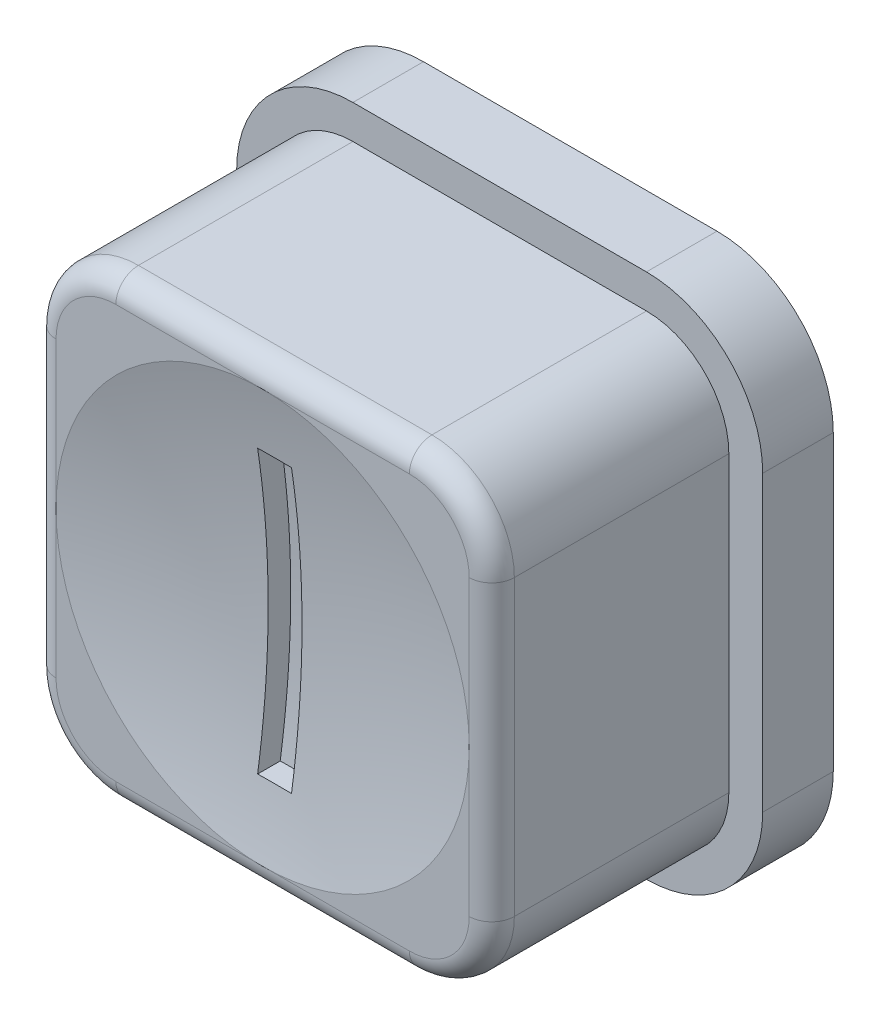
from build123d import *

# Parameters (mm, degrees)
BOSS_EXTRUDE1_DEPTH              = 5.334
FILLET1_R                        = 0.508
BOSS_EXTRUDE2_DEPTH              = 1.5875
F_56_0_0465_DIAMETER_HOLE1_D     = 1.1811
F_56_0_0465_DIAMETER_HOLE1_DEPTH = 5.08
CUT_EXTRUDE3_REACH               = 13.369
CUT_EXTRUDE3_START_RADIUS        = 21.519514579
CUT_EXTRUDE3_END_RADIUS          = 21.519514579
SKETCH9_W                        = 0.762
SKETCH9_H                        = 6.35


with BuildPart() as part:
    # Sketch1 → Boss-Extrude1 (new body)
    with BuildSketch(Plane.XY):
        with BuildLine():
            Line((3.301999954, 5.156199954), (-3.301999954, 5.156199954))
            ThreePointArc((-3.301999954, 5.156199954), (-4.613117348, 4.613117348), (-5.156199954, 3.301999954))
            Line((-5.156199954, 3.301999954), (-5.156199954, -3.301999954))
            ThreePointArc((-5.156199954, -3.301999954), (-4.613117348, -4.613117348), (-3.301999954, -5.156199954))
            Line((-3.301999954, -5.156199954), (3.301999954, -5.156199954))
            ThreePointArc((3.301999954, -5.156199954), (4.613117348, -4.613117348), (5.156199954, -3.301999954))
            Line((5.156199954, -3.301999954), (5.156199954, 3.301999954))
            ThreePointArc((5.156199954, 3.301999954), (4.613117348, 4.613117348), (3.301999954, 5.156199954))
        make_face()
    extrude(amount=-BOSS_EXTRUDE1_DEPTH)

    # Fillet1
    fillet1_edges = [part.edges().sort_by_distance(p)[0] for p in [
        (5.156199954, 0, 0),
        (4.613117348, -4.613117348, 0),
        (0, -5.156199954, 0),
        (-4.613117348, -4.613117348, 0),
        (-5.156199954, 0, 0),
        (-4.613117348, 4.613117348, 0),
        (0, 5.156199954, 0),
        (4.613117348, 4.613117348, 0),
    ]]
    fillet(fillet1_edges, radius=FILLET1_R)

    # Sketch4 → Boss-Extrude2 (add)
    with BuildSketch(Plane(origin=(0, 0, -5.334), x_dir=(-1, 0, 0), z_dir=(0, 0, -1))):
        with BuildLine():
            Line((-5.918199954, 3.301999954), (-5.918199954, -3.301999954))
            ThreePointArc((-5.918199954, -3.301999954), (-5.151932715, -5.151932715), (-3.301999954, -5.918199954))
            Line((-3.301999954, -5.918199954), (3.301999954, -5.918199954))
            ThreePointArc((3.301999954, -5.918199954), (5.151932715, -5.151932715), (5.918199954, -3.301999954))
            Line((5.918199954, -3.301999954), (5.918199954, 3.301999954))
            ThreePointArc((5.918199954, 3.301999954), (5.151932715, 5.151932715), (3.301999954, 5.918199954))
            Line((3.301999954, 5.918199954), (-3.301999954, 5.918199954))
            ThreePointArc((-3.301999954, 5.918199954), (-5.151932715, 5.151932715), (-5.918199954, 3.301999954))
        make_face()
    extrude(amount=BOSS_EXTRUDE2_DEPTH)

    # #56 (0.0465) Diameter Hole1
    with Locations(Plane(origin=(0, 0, -6.9215), x_dir=(-1, 0, 0), z_dir=(0, 0, -1))):
        with Locations((0, 0)):
            Hole(F_56_0_0465_DIAMETER_HOLE1_D / 2, depth=F_56_0_0465_DIAMETER_HOLE1_DEPTH)

    # Sketch8 → Cut-Revolve1 (revolve, cut)
    with BuildSketch(Plane(origin=(0, 0, 0), x_dir=(0, 0, -1), z_dir=(1, 0, 0))):
        with BuildLine():
            Line((0, 4.648199954), (0, 0))
            Line((0, 0), (0.508, 0))
            ThreePointArc((0.508, 0), (0.380623019, 2.337938558), (0, 4.648199954))
        make_face()
    revolve(axis=Axis((0, 0, -0.508), (0, 0, 1)), mode=Mode.SUBTRACT)

    # Cut-Extrude3: from a sphere face, 13.369 long prism both ways, kept between that surface and its translate by the depth
    cut_extrude3_start = Location((0, 0, 21.011514579)) * Sphere(CUT_EXTRUDE3_START_RADIUS, mode=Mode.PRIVATE)
    cut_extrude3_end = Location((0, 0, 20.503514579)) * Sphere(CUT_EXTRUDE3_END_RADIUS, mode=Mode.PRIVATE)
    # Sketch9 → Cut-Extrude3 (cut, from a surface)
    with BuildSketch(Plane.XY, mode=Mode.PRIVATE) as cut_extrude3_sk1:
        Rectangle(SKETCH9_W, SKETCH9_H)
    cut_extrude3_tool1 = extrude(cut_extrude3_sk1.sketch, amount=CUT_EXTRUDE3_REACH, both=True, mode=Mode.PRIVATE)
    add(((cut_extrude3_tool1 - cut_extrude3_start) & cut_extrude3_end).solids().sort_by_distance((0, 0, 0))[0], mode=Mode.SUBTRACT)


solid = part.part
